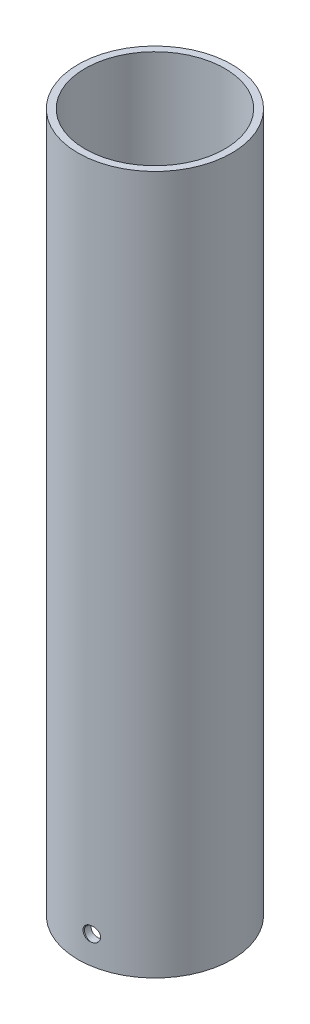
from build123d import *

# Parameters (mm, degrees)
SKETCH1_R           = 55
SKETCH1_R_2         = 50
BOSS_EXTRUDE2_DEPTH = 500


with BuildPart() as part:
    # Sketch1 → Boss-Extrude2 (new body)
    with BuildSketch(Plane(origin=(0, 0, 0), x_dir=(1, 0, 0), z_dir=(0, 1, 0))):
        Circle(SKETCH1_R)
        Circle(SKETCH1_R_2, mode=Mode.SUBTRACT)
    extrude(amount=-BOSS_EXTRUDE2_DEPTH)

    # Sketch6 → 1/8 NPT Tapped Hole1 (revolve, cut)
    with BuildSketch(Plane(origin=(9.081993678, -479.986026958, 55), x_dir=(0, -1, 0), z_dir=(1, 0, 0))):
        Polygon((0, 0), (0, 14.153468714), (4.2164, 11.62), (4.2164, 6.92), (4.955191683, 6.92), (5.143373, 0.635), (5.778373, 0), align=None)
    revolve(axis=Axis((9.081993678, -479.986026958, 61.35), (0, 0, -1)), mode=Mode.SUBTRACT)


solid = part.part
